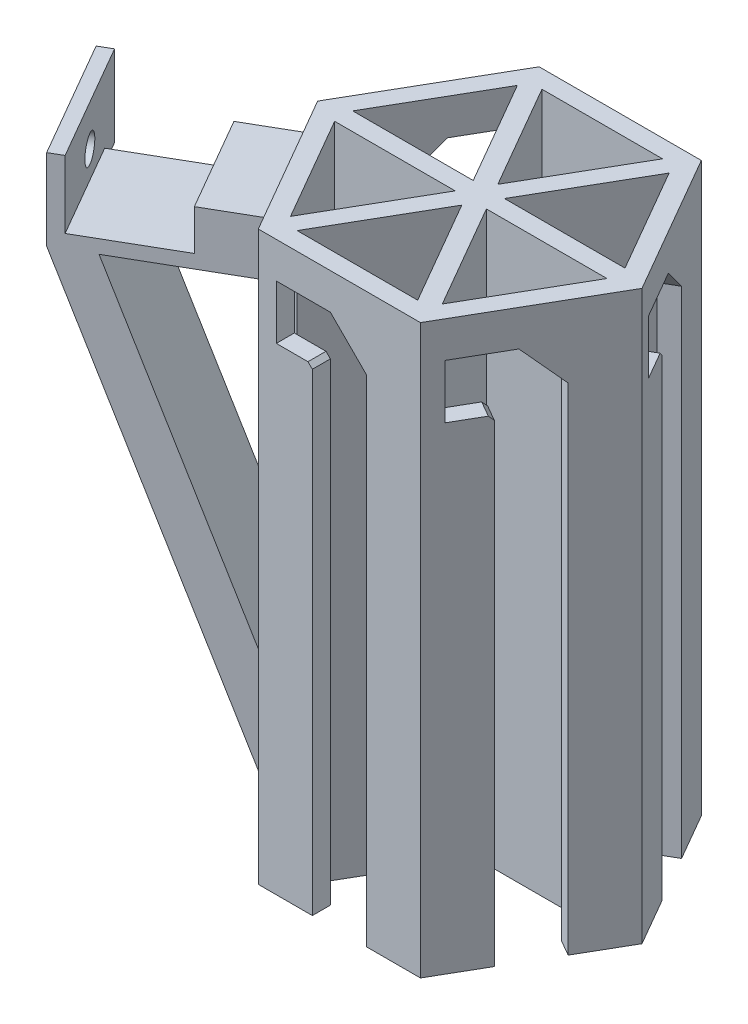
from build123d import *

# Parameters (mm, degrees)
SALIENTE_EXTRUIR1_DEPTH = 10
SALIENTE_EXTRUIR2_DEPTH = 170
CORTAR_EXTRUIR1_DEPTH   = 4
MATRIZC1_COUNT          = 5
MATRIZC1_ANGLE          = 240
CROQUIS4_W              = 24
CROQUIS4_H              = 12
SALIENTE_EXTRUIR3_DEPTH = 36
CROQUIS5_W              = 24
CROQUIS5_H              = 9
CORTAR_EXTRUIR2_DEPTH   = 24
CHAFL_N1_SIZE2          = 36
CHAFL_N1_SIZE           = 98.9091871
CORTAR_EXTRUIR3_DEPTH   = 24
CROQUIS7_W              = 30
CROQUIS7_H              = 18
CROQUIS7_R              = 3
SALIENTE_EXTRUIR4_DEPTH = 3
CROQUIS8_W              = 250
CROQUIS8_H              = 250
CORTAR_EXTRUIR4_DEPTH   = 84
CROQUIS9_R              = 2.5
CORTAR_EXTRUIR5_DEPTH   = 2
CORTAR_EXTRUIR6_DEPTH   = 7.9


with BuildPart() as part:
    # Croquis1 → Saliente-Extruir1 (new body)
    with BuildSketch(Plane(origin=(0, 0, 0), x_dir=(1, 0, 0), z_dir=(0, 1, 0))):
        Polygon((-12, 51.961524227), (-30, 51.961524227), (-39, 36.373066959), (-27, 15.588457268), (-51, 15.588457268), (-60, 0), (-51, -15.588457268), (-27, -15.588457268), (-39, -36.373066959), (-30, -51.961524227), (-12, -51.961524227), (0, -31.176914536), (12, -51.961524227), (30, -51.961524227), (39, -36.373066959), (27, -15.588457268), (51, -15.588457268), (60, 0), (51, 15.588457268), (27, 15.588457268), (39, 36.373066959), (30, 51.961524227), (12, 51.961524227), (0, 31.176914536), align=None)
    extrude(amount=SALIENTE_EXTRUIR1_DEPTH)

    # Croquis2 → Saliente-Extruir2 (add)
    # profile 1 of 2: a face of its own
    with BuildSketch(Plane(origin=(0, 10, 0), x_dir=(1, 0, 0), z_dir=(0, 1, 0))):
        Polygon((36, 0), (18, 31.176914536), (-18, 31.176914536), (-36, 0), (-18, -31.176914536), (18, -31.176914536), align=None)
        Polygon((15.690598923, 27.176914536), (-15.690598923, 27.176914536), (-31.381197846, 0), (-15.690598923, -27.176914536), (15.690598923, -27.176914536), (31.381197846, 0), align=None, mode=Mode.SUBTRACT)
    # profile 2 of 2: a face of its own
    with BuildSketch(Plane(origin=(0, 10, 0), x_dir=(1, 0, 0), z_dir=(0, 1, 0))):
        Polygon((-13.381197846, 27.176914536), (-15.690598923, 27.176914536), (-16.845299462, 25.176914536), (-3.464101615, 2), (-30.226497308, 2), (-31.381197846, 0), (-30.226497308, -2), (-3.464101615, -2), (-16.845299462, -25.176914536), (-15.690598923, -27.176914536), (-13.381197846, -27.176914536), (0, -4), (13.381197846, -27.176914536), (15.690598923, -27.176914536), (16.845299462, -25.176914536), (3.464101615, -2), (30.226497308, -2), (31.381197846, 0), (30.226497308, 2), (3.464101615, 2), (16.845299462, 25.176914536), (15.690598923, 27.176914536), (13.381197846, 27.176914536), (0, 4), align=None)
    extrude(amount=SALIENTE_EXTRUIR2_DEPTH)

    # Croquis3 → Cortar-Extruir1 (cut)
    with BuildSketch(Plane.XY.offset(31.176914536)):
        Polygon((-14, 172), (-2, 172), (6, 164), (6, 44), (-6, 44), (-6, 159.029437252), (-6.970562748, 160), (-14, 160), align=None)
    cortar_extruir1 = extrude(amount=-CORTAR_EXTRUIR1_DEPTH, mode=Mode.SUBTRACT)

    # MatrizC1: Cortar-Extruir1 ×5 about axis
    matrizc1_axis = Axis((0, 0, 0), (0, 1, 0))
    for i in range(1, MATRIZC1_COUNT):
        add(cortar_extruir1.rotate(matrizc1_axis, i * MATRIZC1_ANGLE / (MATRIZC1_COUNT - 1)), mode=Mode.SUBTRACT)

    # Croquis4 → Saliente-Extruir3 (add)
    with BuildSketch(Plane(origin=(-27, 0, 15.588457268), x_dir=(0.5000000000000002, 0, 0.8660254037844386), z_dir=(-0.8660254037844386, 0, 0.5000000000000002))):
        with Locations((0, 172)):
            Rectangle(CROQUIS4_W, CROQUIS4_H)
    extrude(amount=SALIENTE_EXTRUIR3_DEPTH)

    # Croquis5 → Cortar-Extruir2 (cut)
    with BuildSketch(Plane(origin=(-58.176914536, 0, 33.588457268), x_dir=(0.5000000000000003, 0, 0.8660254037844386), z_dir=(-0.8660254037844385, 0, 0.5000000000000002))):
        with Locations((0, 173.5)):
            Rectangle(CROQUIS5_W, CROQUIS5_H)
    extrude(amount=-CORTAR_EXTRUIR2_DEPTH, mode=Mode.SUBTRACT)

    # Chaflán1
    chafl_n1_edges = [part.edges().sort_by_distance(p)[0] for p in [
        (-27, 166, 15.588457268),
    ]]
    chafl_n1_side = [part.faces().sort_by_distance(p)[0] for p in [
        (-27, 165.28, 15.588457268),
    ]]
    chamfer(chafl_n1_edges, length=CHAFL_N1_SIZE - 0.0001, length2=CHAFL_N1_SIZE2 - 0.0001, reference=chafl_n1_side[0])  # a hair under: the kernel refuses the full size

    # Croquis6 → Cortar-Extruir3 (cut)
    with BuildSketch(Plane(origin=(-6, 0, -10.392304845), x_dir=(-0.8660254037844385, 0, 0.5000000000000003), z_dir=(-0.5000000000000003, 0, -0.8660254037844385))):
        Polygon((58.663492356, 166), (31.176914536, 90.481248101), (31.176914536, 166), align=None)
    extrude(amount=-CORTAR_EXTRUIR3_DEPTH, mode=Mode.SUBTRACT)

    # Croquis7 → Saliente-Extruir4 (add)
    with BuildSketch(Plane(origin=(-58.176914536, 0, 33.588457268), x_dir=(0.5000000000000003, 0, 0.8660254037844386), z_dir=(-0.8660254037844385, 0, 0.5000000000000002))):
        with Locations((-3, 175)):
            Rectangle(CROQUIS7_W, CROQUIS7_H)
        with Locations((-3, 175)):
            Circle(CROQUIS7_R, mode=Mode.SUBTRACT)
    extrude(amount=-SALIENTE_EXTRUIR4_DEPTH)

    # Croquis8 → Cortar-Extruir4 (cut)
    with BuildSketch(Plane(origin=(0, 54, 0), x_dir=(1, 0, 0), z_dir=(0, 1, 0))):
        Rectangle(CROQUIS8_W, CROQUIS8_H)
    extrude(amount=-CORTAR_EXTRUIR4_DEPTH, mode=Mode.SUBTRACT)

    # Croquis9 → Cortar-Extruir5 (cut)
    with BuildSketch(Plane.XZ.offset(-54)):
        with Locations(Location((0, 0, 0), (0, 0, 270))):
            Circle(CROQUIS9_R)
    extrude(amount=-CORTAR_EXTRUIR5_DEPTH, mode=Mode.SUBTRACT)

    # Croquis10 → Cortar-Extruir6 (cut)
    with BuildSketch(Plane.XZ.offset(-56)):
        with BuildLine():
            Line((1.528888485, 0.95), (-1.528888485, 0.95))
            ThreePointArc((-1.528888485, 0.95), (-1.8, 0), (-1.528888485, -0.95))
            Line((-1.528888485, -0.95), (1.528888485, -0.95))
            ThreePointArc((1.528888485, -0.95), (1.730895617, -0.493963929), (1.8, 0))
            ThreePointArc((1.8, 0), (1.730895617, 0.493963929), (1.528888485, 0.95))
        make_face()
    extrude(amount=-CORTAR_EXTRUIR6_DEPTH, mode=Mode.SUBTRACT)


solid = part.part
